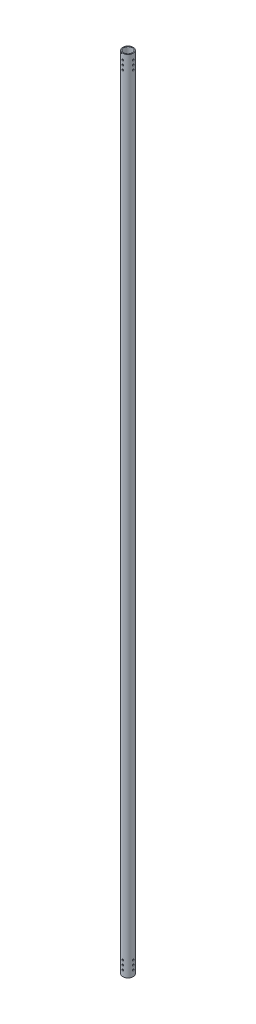
from build123d import *

# Parameters (mm, degrees)
EXTRUDE_1_OUTLINE_R                = 18
EXTRUDE_1_OUTLINE_R_2              = 15
EXTRUDE_1_DEPTH                    = 2790
SKETCH_2_R                         = 3
CUT_EXTRUDE_1_DEPTH                = 2791.116126616
PATTERN_LINEAR_1_COUNT             = 3
PATTERN_LINEAR_1_PITCH             = 15
PATTERN_CIRCULAR_1_COUNT           = 2
PATTERN_CIRCULAR_1_ANGLE           = 90
PATTERN_CIRCULAR_1_COPY_1_SKETCH_R = 3
PATTERN_CIRCULAR_1_COPY_1_DEPTH    = 2791.116126616
PATTERN_CIRCULAR_1_COPY_2_SKETCH_R = 3
PATTERN_CIRCULAR_1_COPY_2_DEPTH    = 2791.116126616


# Read off the part's stored shape, not the designer's step: Вытянуть-Тонкостенный1
with BuildPart() as part:
    # Вытянуть-Тонкостенный1 outline → Вытянуть-Тонкостенный1 (new body)
    with BuildSketch(Plane(origin=(0, 0, 0), x_dir=(1, 0, 0), z_dir=(0, 1, 0))):
        Circle(EXTRUDE_1_OUTLINE_R)
        Circle(EXTRUDE_1_OUTLINE_R_2, mode=Mode.SUBTRACT)
    extrude(amount=EXTRUDE_1_DEPTH)

    # Эскиз2 → Вырез-Вытянуть1 (cut, symmetric)
    with BuildSketch(Plane.XY):
        with Locations((0, 2740)):
            Circle(SKETCH_2_R)
        with Locations((0, 44)):
            Circle(SKETCH_2_R)
    cut_extrude_1 = extrude(amount=CUT_EXTRUDE_1_DEPTH, both=True, mode=Mode.SUBTRACT)

    # Линейный массив1: Вырез-Вытянуть1 ×3
    with Locations(*[(0, i * PATTERN_LINEAR_1_PITCH, 0) for i in range(1, PATTERN_LINEAR_1_COUNT)]):
        add(cut_extrude_1, mode=Mode.SUBTRACT)

    # Круговой массив1: Вырез-Вытянуть1 ×2 about axis
    pattern_circular_1_axis = Axis((0, 2790, 0), (0, -1, 0))
    for i in range(1, PATTERN_CIRCULAR_1_COUNT):
        add(cut_extrude_1.rotate(pattern_circular_1_axis, i * PATTERN_CIRCULAR_1_ANGLE / (PATTERN_CIRCULAR_1_COUNT - 1)), mode=Mode.SUBTRACT)

    # Круговой массив1 copy 1 sketch → Круговой массив1 copy 1 (cut, symmetric)
    with BuildSketch(Plane(origin=(0, 15, 0), x_dir=(0, 0, 1), z_dir=(-1, 0, 0))):
        with Locations((0, 2740)):
            Circle(PATTERN_CIRCULAR_1_COPY_1_SKETCH_R)
        with Locations((0, 44)):
            Circle(PATTERN_CIRCULAR_1_COPY_1_SKETCH_R)
    extrude(amount=PATTERN_CIRCULAR_1_COPY_1_DEPTH, both=True, mode=Mode.SUBTRACT)

    # Круговой массив1 copy 2 sketch → Круговой массив1 copy 2 (cut, symmetric)
    with BuildSketch(Plane(origin=(0, 30, 0), x_dir=(0, 0, 1), z_dir=(-1, 0, 0))):
        with Locations((0, 2740)):
            Circle(PATTERN_CIRCULAR_1_COPY_2_SKETCH_R)
        with Locations((0, 44)):
            Circle(PATTERN_CIRCULAR_1_COPY_2_SKETCH_R)
    extrude(amount=PATTERN_CIRCULAR_1_COPY_2_DEPTH, both=True, mode=Mode.SUBTRACT)

    # Surface Cut 1
    split(bisect_by=Plane(origin=(0, 24, 0), x_dir=(1, 0, 0), z_dir=(0, 1, 0)), keep=Keep.TOP)


solid = part.part
